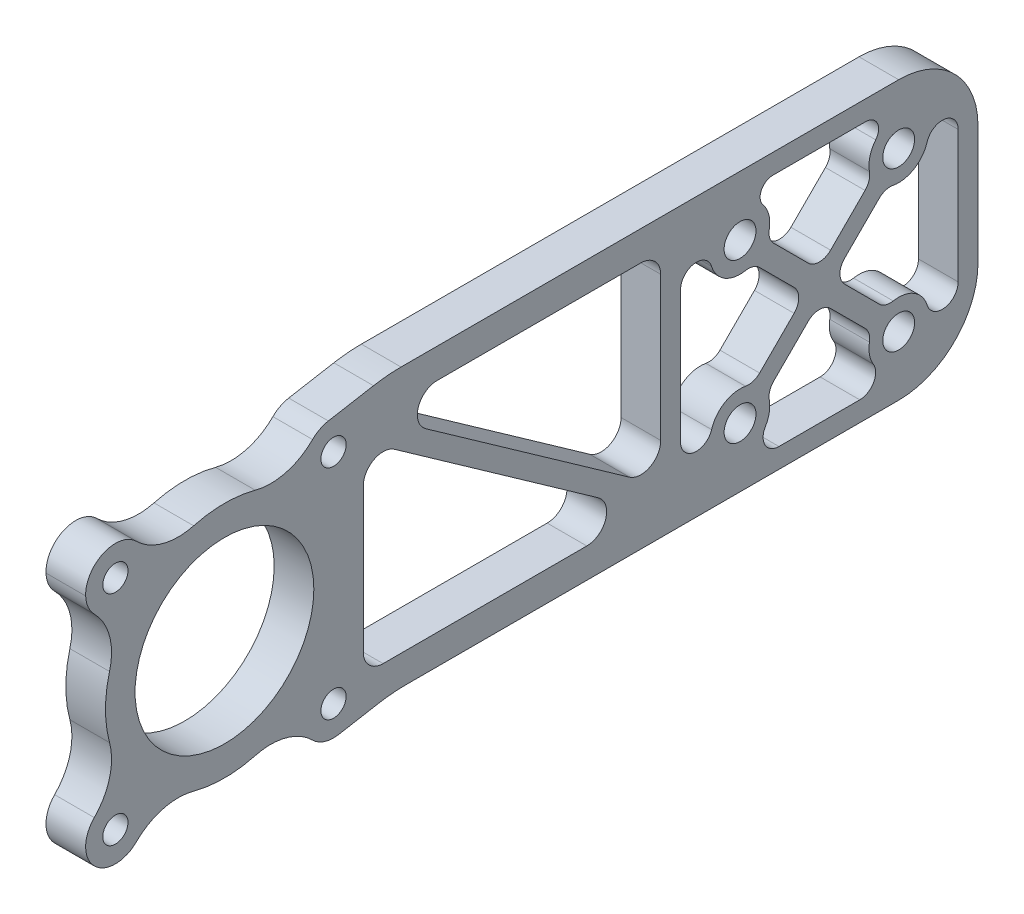
from build123d import *

# Parameters (mm, degrees)
SKETCH1_W               = 144.4879
SKETCH1_H               = 47.625
SKETCH1_R               = 14.3129
BOSS_EXTRUDE1_DEPTH     = 6.35
FILLET1_R               = 12.7
F_10_32_TAPPED_HOLE1_D  = 4.0386
F_10_CLEARANCE_HOLE1_D  = 5.1054
CUT_EXTRUDE2_DEPTH      = 147.5745916
CUT_EXTRUDE2_DEPTH_BACK = 147.5745916
DELETEFACE1_OUTLINE_W   = 6.35
DELETEFACE1_OUTLINE_H   = 31.75
DELETEFACE1_DEPTH       = 5
FILLET3_R               = 12.7
CUT_EXTRUDE1_DEPTH      = 147.5745916
CUT_EXTRUDE3_DEPTH      = 147.5745916
CUT_EXTRUDE3_DEPTH_BACK = 147.5745916
FILLET2_R               = 2.54
DELETEFACE2_DEPTH       = 6.35
FILLET4_R               = 25.4


with BuildPart() as part:
    # Sketch1 → Boss-Extrude1 (new body)
    with BuildSketch(Plane(origin=(0, 0, 0), x_dir=(0, 0, -1), z_dir=(1, 0, 0))):
        with Locations((-72.24395, 0)):
            Rectangle(SKETCH1_W, SKETCH1_H)
        with Locations((-120.65, 0)):
            Circle(SKETCH1_R, mode=Mode.SUBTRACT)
    extrude(amount=BOSS_EXTRUDE1_DEPTH)

    # Fillet1
    fillet1_edges = [part.edges().sort_by_distance(p)[0] for p in [
        (3.175, -23.8125, 144.4879),
        (3.175, 23.8125, 144.4879),
        (3.175, 23.8125, 0),
        (3.175, -23.8125, 0),
    ]]
    fillet(fillet1_edges, radius=FILLET1_R)

    # #10-32 Tapped Hole1 (through all)
    with Locations(Plane.ZY):
        with Locations((103.1875, 17.4625), (138.1125, 17.4625), (138.1125, -17.4625), (103.1875, -17.4625)):
            Hole(F_10_32_TAPPED_HOLE1_D / 2)

    # #10 Clearance Hole1 (through all)
    with Locations(Plane(origin=(6.35, 0, 0), x_dir=(0, 0, -1), z_dir=(1, 0, 0))):
        with Locations((-12.7, 14.2875), (-38.1, 14.2875), (-38.1, -11.1125), (-12.7, -11.1125)):
            Hole(F_10_CLEARANCE_HOLE1_D / 2)

    # Sketch9 → Cut-Extrude2 (cut, two sides: drawn at the far end of the back side and taken through both)
    with BuildSketch(Plane(origin=(6.35, 0, 0), x_dir=(0, 0, -1), z_dir=(1, 0, 0)).offset(-CUT_EXTRUDE2_DEPTH_BACK)):
        with BuildLine():
            Line((312.341235999, -20.6375), (0, -20.6375))
            Line((0, -20.6375), (-89.737984171, -20.6375))
            ThreePointArc((-89.737984171, -20.6375), (-93.626549138, -21.4674044), (-96.8375, -23.8125))
            Line((-96.8375, -23.8125), (-305.064990666, -256.617911957))
            Line((-305.064990666, -256.617911957), (-82.038945456, -840.131042898))
            Line((-82.038945456, -840.131042898), (535.36728121, -604.150630941))
            Line((535.36728121, -604.150630941), (312.341235999, -20.6375))
        make_face()
    extrude(amount=CUT_EXTRUDE2_DEPTH + CUT_EXTRUDE2_DEPTH_BACK, mode=Mode.SUBTRACT)

    # DeleteFace1: read off the stored shape, not the designer's step
    # DeleteFace1 outline → DeleteFace1 (add)
    with BuildSketch(Plane.XY):
        with Locations((3.175, -4.7625)):
            Rectangle(DELETEFACE1_OUTLINE_W, DELETEFACE1_OUTLINE_H)
    extrude(amount=DELETEFACE1_DEPTH)

    # Fillet3
    fillet3_edges = [part.edges().sort_by_distance(p)[0] for p in [
        (3.175, -23.8125, 96.8375),
        (3.175, -20.6375, 0),
    ]]
    fillet(fillet3_edges, radius=FILLET3_R)

    # Sketch8 → Cut-Extrude1 (cut, through all)
    with BuildSketch(Plane(origin=(6.35, 0, 0), x_dir=(0, 0, -1), z_dir=(1, 0, 0))):
        with BuildLine():
            ThreePointArc((-34.03708705, -13.597282609), (-33.343854424, -11.358438021), (-33.802467985, -9.060032015))
            Line((-33.802467985, -9.060032015), (-25.4, -0.65756403))
            Line((-25.4, -0.65756403), (-16.997532015, -9.060032015))
            ThreePointArc((-16.997532015, -9.060032015), (-17.456145576, -11.358438021), (-16.76291295, -13.597282609))
            ThreePointArc((-16.76291295, -13.597282609), (-16.714212781, -16.164584503), (-18.929799856, -17.4625))
            Line((-18.929799856, -17.4625), (-31.870200144, -17.4625))
            ThreePointArc((-31.870200144, -17.4625), (-34.085787219, -16.164584503), (-34.03708705, -13.597282609))
        make_face()
        with BuildLine():
            ThreePointArc((-8.144565217, 12.898464294), (-10.781394154, 9.928560008), (-14.752467985, 9.989967985))
            Line((-14.752467985, 9.989967985), (-23.15493597, 1.5875))
            Line((-23.15493597, 1.5875), (-14.752467985, -6.814967985))
            ThreePointArc((-14.752467985, -6.814967985), (-10.781394154, -6.753560008), (-8.144565217, -9.723464294))
            ThreePointArc((-8.144565217, -9.723464294), (-5.340497431, -11.494884855), (-3.175, -8.982645251))
            Line((-3.175, -8.982645251), (-3.175, 12.157645251))
            ThreePointArc((-3.175, 12.157645251), (-5.340497431, 14.669884855), (-8.144565217, 12.898464294))
        make_face()
        with BuildLine():
            Line((-32.854039054, 20.6375), (-17.945960946, 20.6375))
            ThreePointArc((-17.945960946, 20.6375), (-16.10842501, 19.472959326), (-16.37707543, 17.314135514))
            ThreePointArc((-16.37707543, 17.314135514), (-17.427358043, 14.864987824), (-16.997532015, 12.235032015))
            Line((-16.997532015, 12.235032015), (-25.4, 3.83256403))
            Line((-25.4, 3.83256403), (-33.802467985, 12.235032015))
            ThreePointArc((-33.802467985, 12.235032015), (-33.372641957, 14.864987824), (-34.42292457, 17.314135514))
            ThreePointArc((-34.42292457, 17.314135514), (-34.69157499, 19.472959326), (-32.854039054, 20.6375))
        make_face()
        with BuildLine():
            ThreePointArc((-47.625, 12.157645251), (-45.459502569, 14.669884855), (-42.655434783, 12.898464294))
            ThreePointArc((-42.655434783, 12.898464294), (-40.018605846, 9.928560008), (-36.047532015, 9.989967985))
            Line((-36.047532015, 9.989967985), (-27.64506403, 1.5875))
            Line((-27.64506403, 1.5875), (-36.047532015, -6.814967985))
            ThreePointArc((-36.047532015, -6.814967985), (-40.018605846, -6.753560008), (-42.655434783, -9.723464294))
            ThreePointArc((-42.655434783, -9.723464294), (-45.459502569, -11.494884855), (-47.625, -8.982645251))
            Line((-47.625, -8.982645251), (-47.625, 12.157645251))
        make_face()
        with BuildLine():
            ThreePointArc((-88.423043936, 13.28129417), (-89.618027137, 16.835627136), (-86.591838031, 19.05))
            Line((-86.591838031, 19.05), (-53.975, 19.05))
            ThreePointArc((-53.975, 19.05), (-51.72993597, 18.12006403), (-50.8, 15.875))
            Line((-50.8, 15.875), (-50.8, -7.153111257))
            ThreePointArc((-50.8, -7.153111257), (-52.514427124, -9.972216057), (-55.806205905, -9.746817086))
            Line((-55.806205905, -9.746817086), (-88.423043936, 13.28129417))
        make_face()
        with BuildLine():
            ThreePointArc((-60.801956064, -10.10629417), (-59.606972863, -13.660627136), (-62.633161969, -15.875))
            Line((-62.633161969, -15.875), (-95.25, -15.875))
            ThreePointArc((-95.25, -15.875), (-97.49506403, -14.94506403), (-98.425, -12.7))
            Line((-98.425, -12.7), (-98.425, 10.328111257))
            ThreePointArc((-98.425, 10.328111257), (-96.710572876, 13.147216057), (-93.418794095, 12.921817086))
            Line((-93.418794095, 12.921817086), (-60.801956064, -10.10629417))
        make_face()
    extrude(amount=-CUT_EXTRUDE1_DEPTH, mode=Mode.SUBTRACT)

    # Sketch10 → Cut-Extrude3 (cut, two sides: drawn at the far end of the back side and taken through both)
    with BuildSketch(Plane(origin=(6.35, 0, 0), x_dir=(0, 0, -1), z_dir=(1, 0, 0)).offset(-CUT_EXTRUDE3_DEPTH_BACK)):
        with BuildLine():
            Line((132.08732827, -20.6375), (-89.737984171, -20.6375))
            Line((-89.737984171, -20.6375), (-93.767675351, -20.6375))
            Line((-93.767675351, -20.6375), (-102.360500554, -22.152646924))
            ThreePointArc((-102.360500554, -22.152646924), (-104.611498636, -22.007126952), (-106.543048055, -20.842101086))
            ThreePointArc((-106.543048055, -20.842101086), (-110.805342188, -18.396467904), (-115.719429444, -18.400868838))
            ThreePointArc((-115.719429444, -18.400868838), (-120.65, -19.05), (-125.580570556, -18.400868838))
            ThreePointArc((-125.580570556, -18.400868838), (-130.494657812, -18.396467904), (-134.756951945, -20.842101086))
            ThreePointArc((-134.756951945, -20.842101086), (-141.480096045, -20.830096045), (-141.492101086, -14.106951945))
            ThreePointArc((-141.492101086, -14.106951945), (-139.046467904, -9.844657812), (-139.050868838, -4.930570556))
            ThreePointArc((-139.050868838, -4.930570556), (-139.7, 0), (-139.050868838, 4.930570556))
            ThreePointArc((-139.050868838, 4.930570556), (-139.046467904, 9.844657812), (-141.492101086, 14.106951945))
            ThreePointArc((-141.492101086, 14.106951945), (-141.480096045, 20.830096045), (-134.756951945, 20.842101086))
            ThreePointArc((-134.756951945, 20.842101086), (-130.494657812, 18.396467904), (-125.580570556, 18.400868838))
            ThreePointArc((-125.580570556, 18.400868838), (-120.65, 19.05), (-115.719429444, 18.400868838))
            ThreePointArc((-115.719429444, 18.400868838), (-110.805342188, 18.396467904), (-106.543048055, 20.842101086))
            ThreePointArc((-106.543048055, 20.842101086), (-105.379031086, 21.690809089), (-104.014499446, 22.152646924))
            Line((-104.014499446, 22.152646924), (-94.601004871, 23.8125))
            Line((-94.601004871, 23.8125), (123.854282635, 62.332061266))
            Line((123.854282635, 62.332061266), (-317.628130355, 18.523888755))
            Line((-317.628130355, 18.523888755), (-309.39508472, -64.445672511))
            Line((-309.39508472, -64.445672511), (132.08732827, -20.6375))
        make_face()
    extrude(amount=CUT_EXTRUDE3_DEPTH + CUT_EXTRUDE3_DEPTH_BACK, mode=Mode.SUBTRACT)

    # Fillet2
    fillet2_edges = [part.edges().sort_by_distance(p)[0] for p in [
        (3.175, 9.989967985, 36.047532015),
        (3.175, 1.5875, 27.64506403),
        (3.175, -6.814967985, 36.047532015),
        (3.175, -6.814967985, 14.752467985),
        (3.175, 1.5875, 23.15493597),
        (3.175, 9.989967985, 14.752467985),
        (3.175, 12.235032015, 16.997532015),
        (3.175, 3.83256403, 25.4),
        (3.175, 12.235032015, 33.802467985),
        (3.175, -9.060032015, 33.802467985),
        (3.175, -0.65756403, 25.4),
        (3.175, -9.060032015, 16.997532015),
    ]]
    fillet(fillet2_edges, radius=FILLET2_R)

    # DeleteFace2: read off the stored shape, not the designer's step
    # DeleteFace2 outline → DeleteFace2 (add)
    with BuildSketch(Plane.YZ):
        with BuildLine():
            ThreePointArc((22.221939477, 137.941789381), (20.836837959, 141.473340607), (17.310866585, 142.872585457))
            ThreePointArc((17.310866585, 142.872585457), (20.110734558, 140.750141619), (22.221939477, 137.941789381))
        make_face()
        with BuildLine():
            ThreePointArc((-17.310866585, 142.872585457), (-20.836837959, 141.473340607), (-22.221939477, 137.941789381))
            ThreePointArc((-22.221939477, 137.941789381), (-20.110734558, 140.750141619), (-17.310866585, 142.872585457))
        make_face()
    extrude(amount=DELETEFACE2_DEPTH)

    # Fillet4
    fillet4_edges = [part.edges().sort_by_distance(p)[0] for p in [
        (3.175, 23.8125, 94.601004871),
        (3.175, -20.6375, 93.767675351),
    ]]
    fillet(fillet4_edges, radius=FILLET4_R)


solid = part.part
